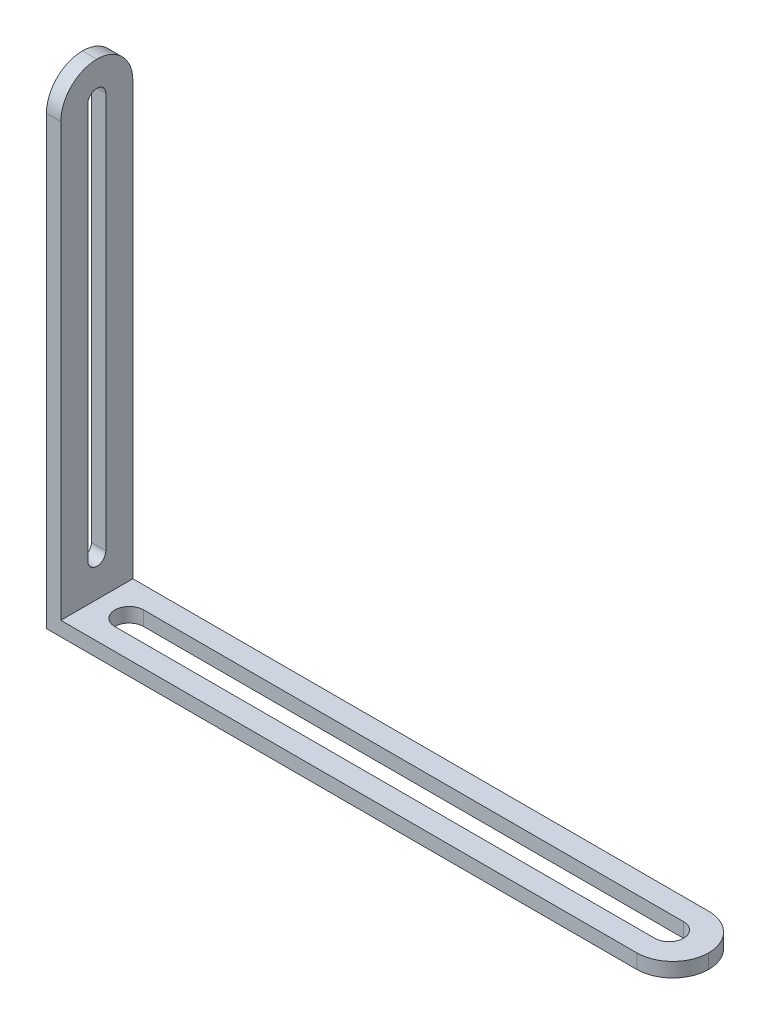
from build123d import *

# Parameters (mm, degrees)
BOSS_EXTRUDE1_DEPTH = 25.4
FILLET1_R           = 12.7
CUT_EXTRUDE1_DEPTH  = 25.4
CUT_EXTRUDE3_DEPTH  = 25.4


with BuildPart() as part:
    # Sketch1 → Boss-Extrude1 (new body)
    with BuildSketch(Plane.XY):
        Polygon((0, 170.18), (5.08, 170.18), (5.08, 5.08), (220.98, 5.08), (220.98, 0), (0, 0), align=None)
    extrude(amount=-BOSS_EXTRUDE1_DEPTH)

    # Fillet1
    fillet1_edges = [part.edges().sort_by_distance(p)[0] for p in [
        (220.98, 2.54, -25.4),
        (220.98, 2.54, 0),
        (2.54, 170.18, -25.4),
        (2.54, 170.18, 0),
    ]]
    fillet(fillet1_edges, radius=FILLET1_R - 0.0001)  # a hair under: the kernel refuses the full size

    # Sketch4 → Cut-Extrude1 (cut)
    with BuildSketch(Plane(origin=(5.08, 0, 0), x_dir=(0, 0, -1), z_dir=(1, 0, 0))):
        with BuildLine():
            Line((9.525, 158.115), (9.525, 18.415))
            ThreePointArc((9.525, 18.415), (12.7, 15.24), (15.875, 18.415))
            Line((15.875, 18.415), (15.875, 158.115))
            ThreePointArc((15.875, 158.115), (12.7, 161.29), (9.525, 158.115))
        make_face()
    extrude(amount=-CUT_EXTRUDE1_DEPTH, mode=Mode.SUBTRACT)

    # Sketch5 → Cut-Extrude3 (cut)
    with BuildSketch(Plane(origin=(0, 5.08, 0), x_dir=(1, 0, 0), z_dir=(0, 1, 0))):
        with BuildLine():
            Line((207.01, 17.78), (16.51, 17.78))
            ThreePointArc((16.51, 17.78), (11.43, 12.7), (16.51, 7.62))
            Line((16.51, 7.62), (207.01, 7.62))
            ThreePointArc((207.01, 7.62), (212.09, 12.7), (207.01, 17.78))
        make_face()
    extrude(amount=-CUT_EXTRUDE3_DEPTH, mode=Mode.SUBTRACT)


solid = part.part
